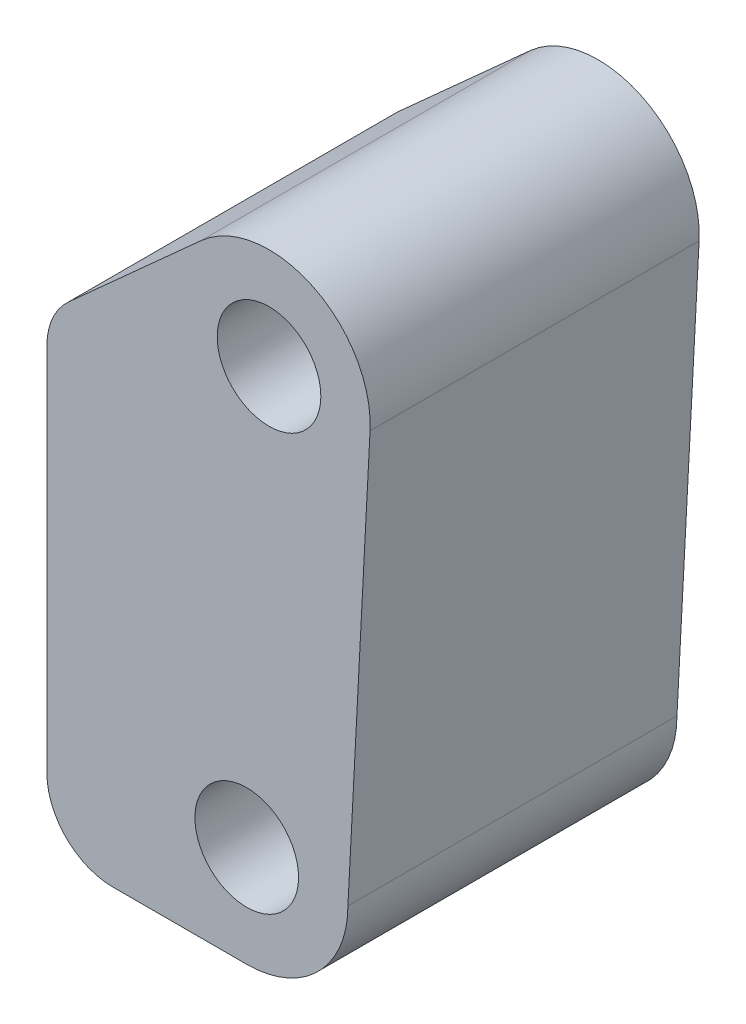
from build123d import *

# Parameters (mm, degrees)
SKETCH1_R           = 1.575
BOSS_EXTRUDE1_DEPTH = 5


with BuildPart() as part:
    # Sketch1 → Boss-Extrude1 (new, symmetric)
    with BuildSketch(Plane.XY):
        with BuildLine():
            Line((2.397918833, -13), (3.070785819, -0.160933065))
            ThreePointArc((3.070785819, -0.160933065), (1.323821623, 2.775449749), (-2.057576615, 2.285170338))
            Line((-2.057576615, 2.285170338), (-6.088261213, -1.344074375))
            ThreePointArc((-6.088261213, -1.344074375), (-6.577090915, -2.01689074), (-6.75, -2.830364026))
            Line((-6.75, -2.830364026), (-6.75, -14.075))
            ThreePointArc((-6.75, -14.075), (-6.164213562, -15.489213562), (-4.75, -16.075))
            Line((-4.75, -16.075), (-0.677081167, -16.075))
            ThreePointArc((-0.677081167, -16.075), (1.497272185, -15.174353352), (2.397918833, -13))
        make_face()
        with Locations((-0.677081167, -13)):
            Circle(SKETCH1_R, mode=Mode.SUBTRACT)
        Circle(SKETCH1_R, mode=Mode.SUBTRACT)
    extrude(amount=BOSS_EXTRUDE1_DEPTH, both=True)


solid = part.part
